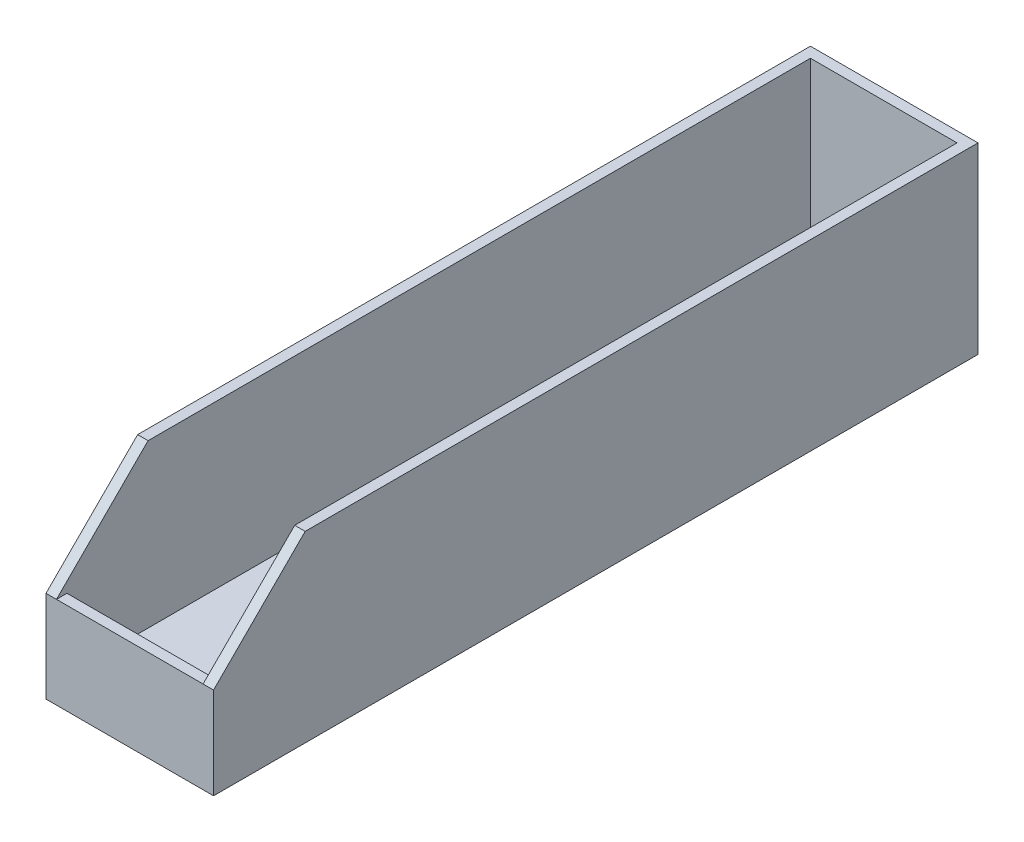
from build123d import *

# Parameters (mm, degrees)
SKETCH1_W           = 28
SKETCH1_H           = 142
BOSS_EXTRUDE1_DEPTH = 4
BOSS_EXTRUDE2_DEPTH = 35
SKETCH1_5_W         = 28
SKETCH1_5_H         = 2
BOSS_EXTRUDE3_DEPTH = 17.5
CUT_EXTRUDE1_REACH  = 82.907
SKETCH2_R           = 1.7
SKETCH2_3_R         = 2.5
SKETCH2_3_R_2       = 1.7
CUT_EXTRUDE2_DEPTH  = 2
CUT_EXTRUDE3_DEPTH  = 88.051708771


with BuildPart() as part:
    # Sketch1 → Boss-Extrude1 (new body)
    with BuildSketch(Plane(origin=(0, 0, 0), x_dir=(1, 0, 0), z_dir=(0, 1, 0))):
        Rectangle(SKETCH1_W, SKETCH1_H)
    extrude(amount=BOSS_EXTRUDE1_DEPTH)

    # Sketch1<4> → Boss-Extrude2 (add)
    with BuildSketch(Plane(origin=(0, 0, 0), x_dir=(1, 0, 0), z_dir=(0, 1, 0))):
        Polygon((-14, -73), (-14, -71), (-14, 71), (14, 71), (14, -71), (14, -73), (16, -73), (16, 73), (-16, 73), (-16, -73), align=None)
    extrude(amount=BOSS_EXTRUDE2_DEPTH)

    # Sketch1<5> → Boss-Extrude3 (add)
    with BuildSketch(Plane(origin=(0, 0, 0), x_dir=(1, 0, 0), z_dir=(0, 1, 0))):
        with Locations((0, -72)):
            Rectangle(SKETCH1_5_W, SKETCH1_5_H)
    extrude(amount=BOSS_EXTRUDE3_DEPTH)

    # Sketch2 → Cut-Extrude1 (cut, up to next)
    with BuildSketch(Plane(origin=(0, 4, 0), x_dir=(1, 0, 0), z_dir=(0, 1, 0)), mode=Mode.PRIVATE) as cut_extrude1_sk1:
        with Locations((0, 30)):
            Circle(SKETCH2_R)
    cut_extrude1_tool1 = extrude(cut_extrude1_sk1.sketch, amount=-CUT_EXTRUDE1_REACH, mode=Mode.PRIVATE) & part.part
    # Sketch2 → Cut-Extrude1 (cut, up to next)
    with BuildSketch(Plane(origin=(0, 4, 0), x_dir=(1, 0, 0), z_dir=(0, 1, 0)), mode=Mode.PRIVATE) as cut_extrude1_sk2:
        with Locations((0, -30)):
            Circle(SKETCH2_R)
    cut_extrude1_tool2 = extrude(cut_extrude1_sk2.sketch, amount=-CUT_EXTRUDE1_REACH, mode=Mode.PRIVATE) & part.part
    add(cut_extrude1_tool1.solids().sort_by_distance((0, 4, -30))[0], mode=Mode.SUBTRACT)
    add(cut_extrude1_tool2.solids().sort_by_distance((0, 4, 30))[0], mode=Mode.SUBTRACT)

    # Sketch2<3> → Cut-Extrude2 (cut)
    # profile 1 of 2: a face of its own
    with BuildSketch(Plane(origin=(0, 4, 0), x_dir=(1, 0, 0), z_dir=(0, 1, 0))):
        with Locations((0, 30)):
            Circle(SKETCH2_3_R)
        with Locations((0, 30)):
            Circle(SKETCH2_3_R_2, mode=Mode.SUBTRACT)
    # profile 2 of 2: a face of its own
    with BuildSketch(Plane(origin=(0, 4, 0), x_dir=(1, 0, 0), z_dir=(0, 1, 0))):
        with Locations((0, -30)):
            Circle(SKETCH2_3_R)
        with Locations((0, -30)):
            Circle(SKETCH2_3_R_2, mode=Mode.SUBTRACT)
    extrude(amount=-CUT_EXTRUDE2_DEPTH, mode=Mode.SUBTRACT)

    # Sketch3 → Cut-Extrude3 (cut, through all)
    with BuildSketch(Plane(origin=(16, 0, 0), x_dir=(0, 0, -1), z_dir=(1, 0, 0))):
        Polygon((-73, 17.5), (-55.5, 35), (-73, 35), align=None)
    extrude(amount=-CUT_EXTRUDE3_DEPTH, mode=Mode.SUBTRACT)


solid = part.part
